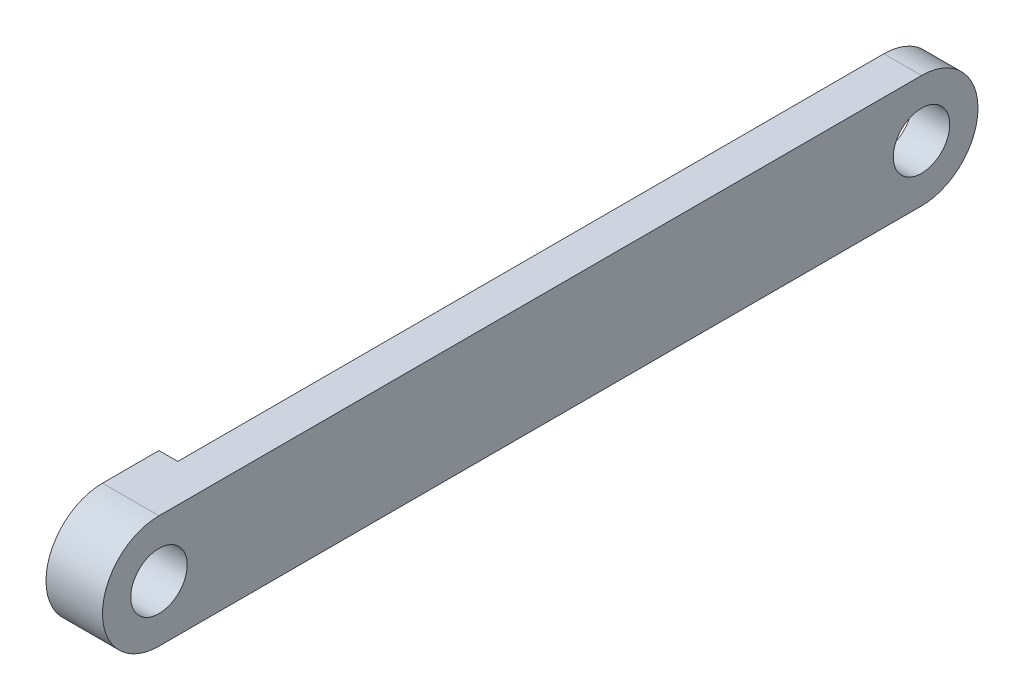
from build123d import *

# Parameters (mm, degrees)
SKETCH1_R           = 1.5
BOSS_EXTRUDE1_DEPTH = 3
SKETCH3_W           = 40.5
SKETCH3_H           = 6
CUT_EXTRUDE2_DEPTH  = 1


with BuildPart() as part:
    # Sketch1 → Boss-Extrude1 (new body)
    with BuildSketch(Plane(origin=(0, 0, 0), x_dir=(0, 0, -1), z_dir=(1, 0, 0))):
        with BuildLine():
            Line((0, 3), (40.5, 3))
            ThreePointArc((40.5, 3), (43.5, 0), (40.5, -3))
            Line((40.5, -3), (0, -3))
            ThreePointArc((0, -3), (-3, 0), (0, 3))
        make_face()
        Circle(SKETCH1_R, mode=Mode.SUBTRACT)
        with Locations((40.5, 0)):
            Circle(SKETCH1_R, mode=Mode.SUBTRACT)
    extrude(amount=BOSS_EXTRUDE1_DEPTH)

    # Sketch3 → Cut-Extrude2 (cut)
    with BuildSketch(Plane.ZY):
        with Locations((-23.25, 0)):
            Rectangle(SKETCH3_W, SKETCH3_H)
    extrude(amount=-CUT_EXTRUDE2_DEPTH, mode=Mode.SUBTRACT)


solid = part.part
